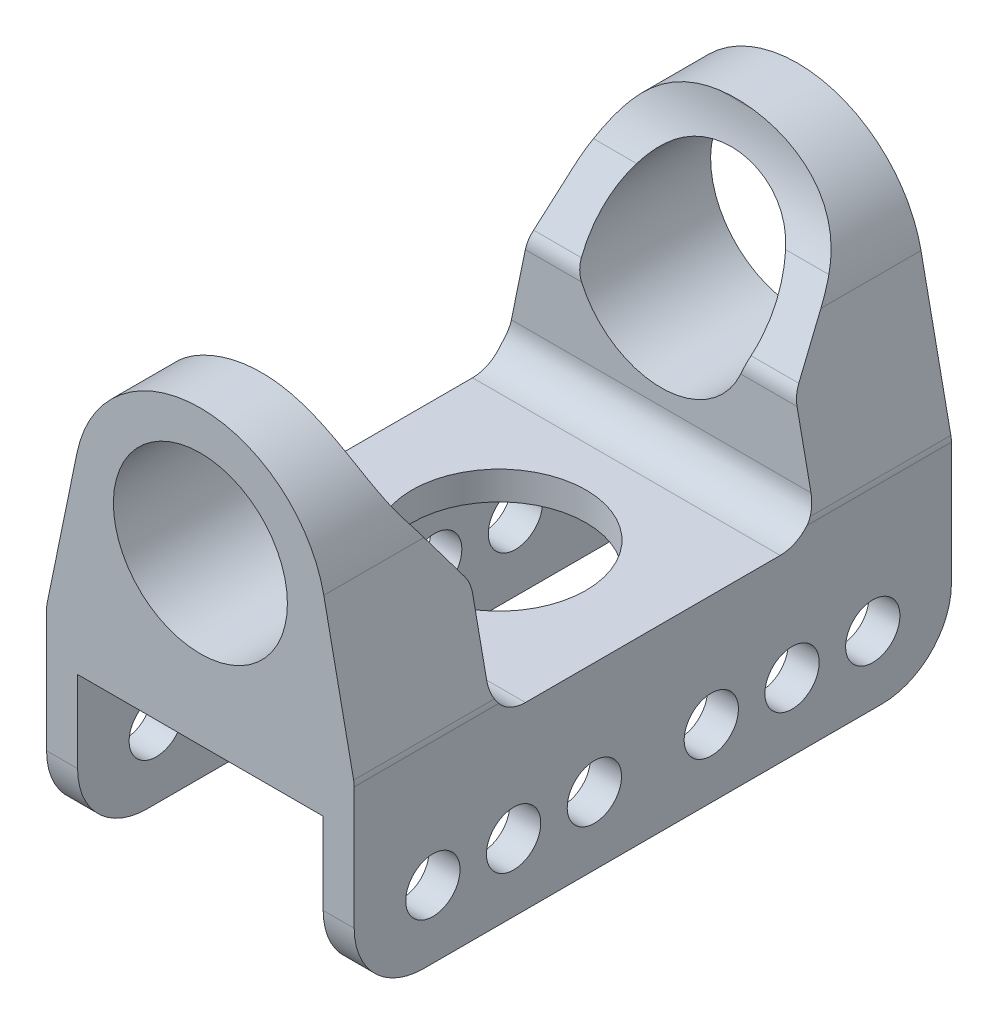
from build123d import *

# Parameters (mm, degrees)
SKETCH1_R           = 7.9375
BOSS_EXTRUDE1_DEPTH = 27.2415
SKETCH2_R           = 2.4765
CUT_EXTRUDE1_DEPTH  = 49.665241675
CUT_EXTRUDE2_DEPTH  = 49.665241675
SKETCH4_R           = 7.9375
CUT_EXTRUDE3_DEPTH  = 41.615884673
FILLET1_R           = 6.35
FILLET2_R           = 3.175
FILLET3_R           = 12.7
FILLET4_R           = 2.54
FILLET5_R           = 2.54


with BuildPart() as part:
    # Sketch1 → Boss-Extrude1 (new, symmetric)
    with BuildSketch(Plane.XY):
        with BuildLine():
            Line((11.25771962, 2.316093955), (14.0335, -11.176))
            Line((14.0335, -11.176), (14.0335, -28.956))
            Line((14.0335, -28.956), (11.2014, -28.956))
            Line((11.2014, -28.956), (11.2014, -15.1638))
            Line((11.2014, -15.1638), (-11.2014, -15.1638))
            Line((-11.2014, -15.1638), (-11.2014, -28.956))
            Line((-11.2014, -28.956), (-14.0335, -28.956))
            Line((-14.0335, -28.956), (-14.0335, -11.176))
            Line((-14.0335, -11.176), (-11.25771962, 2.316093955))
            ThreePointArc((-11.25771962, 2.316093955), (0, 11.4935), (11.25771962, 2.316093955))
        make_face()
        Circle(SKETCH1_R, mode=Mode.SUBTRACT)
    extrude(amount=BOSS_EXTRUDE1_DEPTH, both=True)

    # Sketch2 → Cut-Extrude1 (cut, through all)
    with BuildSketch(Plane(origin=(14.0335, 0, 0), x_dir=(0, 0, -1), z_dir=(1, 0, 0))):
        with Locations(Location((-20.066, -22.7838, 0), (0, 0, 90))):
            Circle(SKETCH2_R)
        with Locations(Location((-12.7, -22.7838, 0), (0, 0, 90))):
            Circle(SKETCH2_R)
        with Locations(Location((-5.334, -22.7838, 0), (0, 0, 90))):
            Circle(SKETCH2_R)
        with Locations(Location((5.334, -22.7838, 0), (0, 0, 90))):
            Circle(SKETCH2_R)
        with Locations(Location((12.7, -22.7838, 0), (0, 0, 90))):
            Circle(SKETCH2_R)
        with Locations(Location((20.066, -22.7838, 0), (0, 0, 90))):
            Circle(SKETCH2_R)
    extrude(amount=-CUT_EXTRUDE1_DEPTH, mode=Mode.SUBTRACT)

    # Sketch3 → Cut-Extrude2 (cut, through all)
    with BuildSketch(Plane(origin=(14.0335, 0, 0), x_dir=(0, 0, -1), z_dir=(1, 0, 0))):
        Polygon((14.7955, -12.573), (-14.7955, -12.573), (-14.7955, -2.413), (-21.6535, 7.38123903), (-21.6535, 11.4935), (21.6535, 11.4935), (21.6535, 7.38123903), (14.7955, -2.413), align=None)
    extrude(amount=-CUT_EXTRUDE2_DEPTH, mode=Mode.SUBTRACT)

    # Sketch4 → Cut-Extrude3 (cut, through all)
    with BuildSketch(Plane.XZ.offset(15.1638)):
        Circle(SKETCH4_R)
    extrude(amount=-CUT_EXTRUDE3_DEPTH, mode=Mode.SUBTRACT)

    # Fillet1
    fillet1_edges = [part.edges().sort_by_distance(p)[0] for p in [
        (12.61745, -28.956, -27.2415),
        (-12.61745, -28.956, -27.2415),
        (-12.61745, -28.956, 27.2415),
        (12.61745, -28.956, 27.2415),
    ]]
    fillet(fillet1_edges, radius=FILLET1_R)

    # Fillet2
    fillet2_edges = [part.edges().sort_by_distance(p)[0] for p in [
        (0, -12.573, 14.7955),
        (0, -12.573, -14.7955),
    ]]
    fillet(fillet2_edges, radius=FILLET2_R)

    # Fillet3
    # the kernel refuses this fillet: 12.7 mm, written as the material it adds along each edge
    with BuildSketch(Plane(origin=(18.820836014, 7.38123903, 21.6535), x_dir=(0, -0.8191520442889931, -0.5735764363510439), z_dir=(-1, 0, 0))) as fillet3_piece_1_section:
        with BuildLine():
            CenterArc((FILLET3_R * 0.315298788879, -FILLET3_R), FILLET3_R, 90, 35)
            Line((-FILLET3_R * 0.258277647472, -FILLET3_R * 0.180847955711), (0, 0))
            Line((0, 0), (FILLET3_R * 0.315298788879, 0))
        make_face()
    fillet3_piece_1 = extrude(amount=25.91246026, mode=Mode.PRIVATE)
    fillet3_piece_1 = fillet3_piece_1 & Plane(origin=(0, 0, 21.359418529), x_dir=(-0.9794857632595162, 0.20151337318382392, 0), z_dir=(0, 0, 1)) * Cylinder(11.4935, 68, mode=Mode.PRIVATE)
    fillet3_piece_1 = fillet3_piece_1 - Plane(origin=(0, 0, 21.359418529), x_dir=(1, 0, 0), z_dir=(0, 0, -1)) * Cylinder(7.9375, 68, mode=Mode.PRIVATE)
    add(fillet3_piece_1)
    with BuildSketch(Plane(origin=(7.091624245, 7.38123903, 21.6535), x_dir=(0, -0.8191520442889934, -0.5735764363510438), z_dir=(-1, 0, 0))) as fillet3_piece_2_section:
        with BuildLine():
            CenterArc((FILLET3_R * 0.315298788879, -FILLET3_R), FILLET3_R, 90, 35)
            Line((-FILLET3_R * 0.258277647472, -FILLET3_R * 0.180847955711), (0, 0))
            Line((0, 0), (FILLET3_R * 0.315298788879, 0))
        make_face()
    fillet3_piece_2 = extrude(amount=25.91246026, mode=Mode.PRIVATE)
    fillet3_piece_2 = fillet3_piece_2 & Plane(origin=(0, 0, 21.359421055), x_dir=(-0.9794857632595162, 0.20151337318382392, 0), z_dir=(0, 0, 1)) * Cylinder(11.4935, 68, mode=Mode.PRIVATE)
    fillet3_piece_2 = fillet3_piece_2 - Plane(origin=(0, 0, 21.359421055), x_dir=(1, 0, 0), z_dir=(0, 0, -1)) * Cylinder(7.9375, 68, mode=Mode.PRIVATE)
    add(fillet3_piece_2)
    with BuildSketch(Plane(origin=(7.091624245, 7.38123903, -21.6535), x_dir=(0, -0.819152044288993, 0.5735764363510443), z_dir=(-1, 0, 0))) as fillet3_piece_3_section:
        with BuildLine():
            CenterArc((FILLET3_R * 0.315298788879, FILLET3_R), FILLET3_R, 235, 35)
            Line((-FILLET3_R * 0.258277647472, FILLET3_R * 0.180847955711), (0, 0))
            Line((0, 0), (FILLET3_R * 0.315298788879, 0))
        make_face()
    fillet3_piece_3 = extrude(amount=25.91246026, mode=Mode.PRIVATE)
    fillet3_piece_3 = fillet3_piece_3 - Plane(origin=(0, 0, -21.359421055), x_dir=(1, 0, 0), z_dir=(0, 0, -1)) * Cylinder(7.9375, 68, mode=Mode.PRIVATE)
    fillet3_piece_3 = fillet3_piece_3 & Plane(origin=(0, 0, -21.359421055), x_dir=(-0.9794857632595162, 0.20151337318382392, 0), z_dir=(0, 0, 1)) * Cylinder(11.4935, 68, mode=Mode.PRIVATE)
    add(fillet3_piece_3)
    with BuildSketch(Plane(origin=(18.820836014, 7.38123903, -21.6535), x_dir=(0, -0.8191520442889931, 0.5735764363510439), z_dir=(-1, 0, 0))) as fillet3_piece_4_section:
        with BuildLine():
            CenterArc((FILLET3_R * 0.315298788879, FILLET3_R), FILLET3_R, 235, 35)
            Line((-FILLET3_R * 0.258277647472, FILLET3_R * 0.180847955711), (0, 0))
            Line((0, 0), (FILLET3_R * 0.315298788879, 0))
        make_face()
    fillet3_piece_4 = extrude(amount=25.91246026, mode=Mode.PRIVATE)
    fillet3_piece_4 = fillet3_piece_4 & Plane(origin=(0, 0, -21.359418529), x_dir=(-0.9794857632595162, 0.20151337318382392, 0), z_dir=(0, 0, 1)) * Cylinder(11.4935, 68, mode=Mode.PRIVATE)
    fillet3_piece_4 = fillet3_piece_4 - Plane(origin=(0, 0, -21.359418529), x_dir=(1, 0, 0), z_dir=(0, 0, -1)) * Cylinder(7.9375, 68, mode=Mode.PRIVATE)
    add(fillet3_piece_4)

    # Fillet4
    fillet4_edges = [part.edges().sort_by_distance(p)[0] for p in [
        (9.89624428, -2.413, -14.7955),
        (-9.89624428, -2.413, -14.7955),
        (-9.89624428, -2.413, 14.7955),
        (9.89624428, -2.413, 14.7955),
    ]]
    fillet(fillet4_edges, radius=FILLET4_R)

    # Fillet5
    fillet5_edges = [part.edges().sort_by_distance(p)[0] for p in [
        (-14.0335, -11.176, 20.746232014),
        (-14.0335, -11.176, -20.746232014),
        (14.0335, -11.176, -20.746232014),
        (14.0335, -11.176, 20.746232014),
    ]]
    fillet(fillet5_edges, radius=FILLET5_R)


solid = part.part
